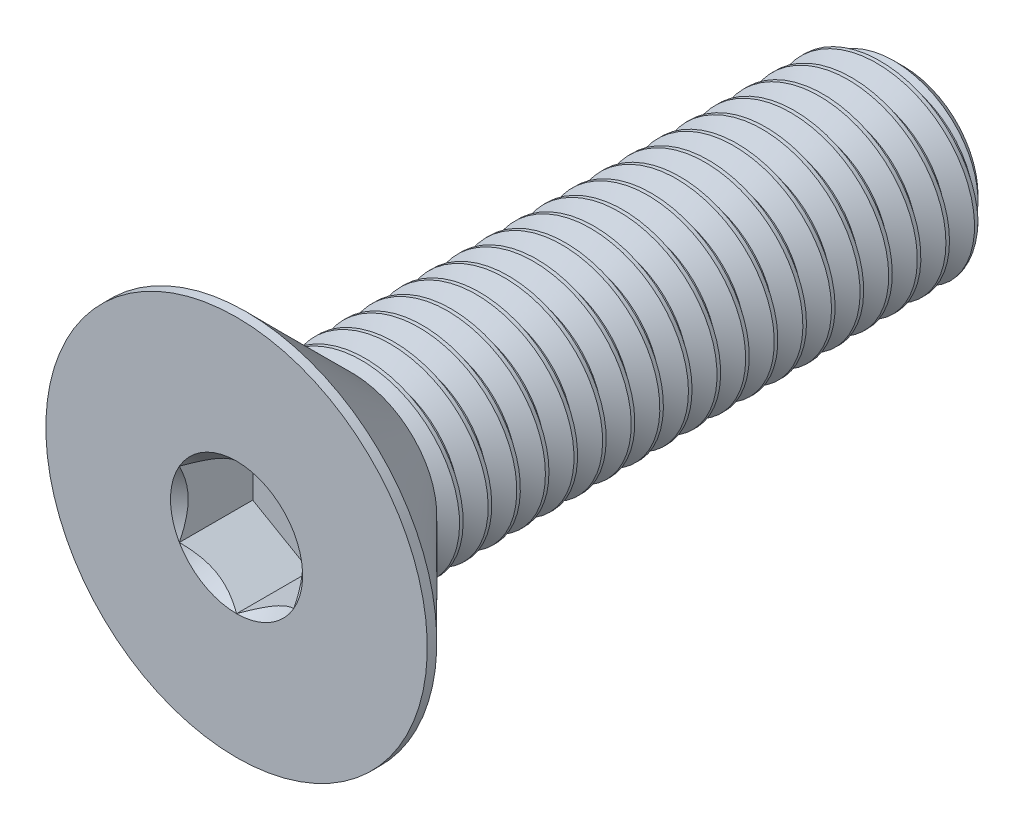
from build123d import *
from build123d.topology import SkipClean

# Parameters (mm, degrees)
SKETCH1_W          = 35
SKETCH1_H          = 5
CHAMFER1_SIZE      = 1.125
CUT_SWEEP1_PITCH   = 1.5
CUT_EXTRUDE2_DEPTH = 3.85


with BuildPart() as part:
    # Sketch1 → Revolve1 (revolve)
    with BuildSketch(Plane(origin=(0, 0, 0), x_dir=(0, 0, -1), z_dir=(1, 0, 0))):
        with Locations((17.5, 2.5)):
            Rectangle(SKETCH1_W, SKETCH1_H)
    revolve(axis=Axis((0, 0, -35), (0, 0, 1)))

    # Chamfer1
    chamfer1_edges = [part.edges().sort_by_distance(p)[0] for p in [
        (0, -5, -35),
    ]]
    chamfer(chamfer1_edges, length=CHAMFER1_SIZE)

    # Cut-Sweep1: arcs per turn and ends read off the stored shape
    # Cut-Sweep1: the profile of Sketch2 profile screwed along a right-hand helix through 25 turns, 8 arcs to a turn; built about Z, then put on its axis
    cut_sweep1_z = Axis((0, 0, 0), (0, 0, 1))
    cut_sweep1_corners = [(5.0003, 0, 0.000173205), (5.0003, 0, -1.312673205), (4.025721421, 0, -0.75), (4.025721421, 0, -0.5625)]
    with BuildLine(mode=Mode.PRIVATE) as cut_sweep1_profile:
        Line(cut_sweep1_corners[0], cut_sweep1_corners[1])
        Line(cut_sweep1_corners[1], cut_sweep1_corners[2])
        Line(cut_sweep1_corners[2], cut_sweep1_corners[3])
        Line(cut_sweep1_corners[3], cut_sweep1_corners[0])
    cut_sweep1_cap = Face(cut_sweep1_profile.wire())
    cut_sweep1_turn_angles = [0, 22.5, 45, 67.5, 90, 112.5, 135, 157.5, 180, 202.5, 225, 247.5, 270, 292.5, 315, 337.5, 360]
    cut_sweep1_turn_weights = [1, 0.9238795325112867, 1, 0.9238795325112867, 1, 0.9238795325112867, 1, 0.9238795325112867, 1, 0.9238795325112867, 1, 0.9238795325112867, 1, 0.9238795325112867, 1, 0.9238795325112867, 1]
    cut_sweep1_turn_rails = [Edge.make_bspline([Vector(p[0], p[1], 0).rotate(cut_sweep1_z, cut_sweep1_turn_angles[k]) / cut_sweep1_turn_weights[k] + Vector(0, 0, p[2] + CUT_SWEEP1_PITCH * cut_sweep1_turn_angles[k] / 360) for k in range(17)], [0, 0, 0, 1, 1, 2, 2, 3, 3, 4, 4, 5, 5, 6, 6, 7, 7, 8, 8, 8], 2, cut_sweep1_turn_weights) for p in cut_sweep1_corners]
    cut_sweep1_turn_sides = [Face.make_surface_from_curves(cut_sweep1_turn_rails[p[0]], cut_sweep1_turn_rails[p[1]]) for p in [(0, 1), (1, 2), (2, 3), (3, 0)]]
    cut_sweep1 = Plane(origin=(0, 0, -35), x_dir=(0, 1, 0), z_dir=(0, 0, 1)) * Solid(Shell([*[p.moved(Location((0, 0, CUT_SWEEP1_PITCH * i))) for i in range(25) for p in cut_sweep1_turn_sides], cut_sweep1_cap, cut_sweep1_cap.rotate(cut_sweep1_z, 9000).moved(Location((0, 0, CUT_SWEEP1_PITCH * 9000 / 360)))]))
    add(cut_sweep1, mode=Mode.SUBTRACT)

    # Sketch7 → Revolve2 (revolve)
    with BuildSketch(Plane(origin=(0, 0, 0), x_dir=(0, 0, -1), z_dir=(1, 0, 0)), mode=Mode.PRIVATE) as revolve2_sk:
        Polygon((0, 10), (0.5, 10), (5.5, 5), (5.5, 0), (0, 0), align=None)
    revolve(revolve2_sk.sketch.rotate(Axis((0, 0, 0), (0, 0, -1)), 180), axis=Axis((0, 0, 0), (0, 0, -1)))

    # Boss-Extrude1 cone 1 section (through the dimple's axis) → Boss-Extrude1 (revolve)
    with SkipClean():  # the faces are left unmerged after this step: merging them gives an invalid solid
        with BuildSketch(Plane(origin=(0, 0, -5.5), x_dir=(0, -1, 0), z_dir=(1, 0, 0))):
            Polygon((0, 0), (5, 0), (0, 5), align=None)
        revolve(axis=Axis((0, 0, -5.5), (0, 0, -1)))

    # Sketch5 → Cut-Extrude2 (cut)
    with SkipClean():  # the faces are left unmerged after this step: merging them gives an invalid solid
        with BuildSketch(Plane.XY):
            Polygon((3, -1.732050808), (3, 1.732050808), (0, 3.464101615), (-3, 1.732050808), (-3, -1.732050808), (0, -3.464101615), align=None)
        extrude(amount=-CUT_EXTRUDE2_DEPTH, mode=Mode.SUBTRACT)

    # Cut-Extrude3 cone 1 section (through the dimple's axis) → Cut-Extrude3 (revolve, cut)
    with SkipClean():  # the faces are left unmerged after this step: merging them gives an invalid solid
        with BuildSketch(Plane(origin=(0, 0, 0), x_dir=(0, -1, 0), z_dir=(1, 0, 0))):
            Polygon((0, 0), (3.464101615, 0), (0, 3.464101615), align=None)
        revolve(axis=Axis((0, 0, 0), (0, 0, -1)), mode=Mode.SUBTRACT)


solid = part.part
